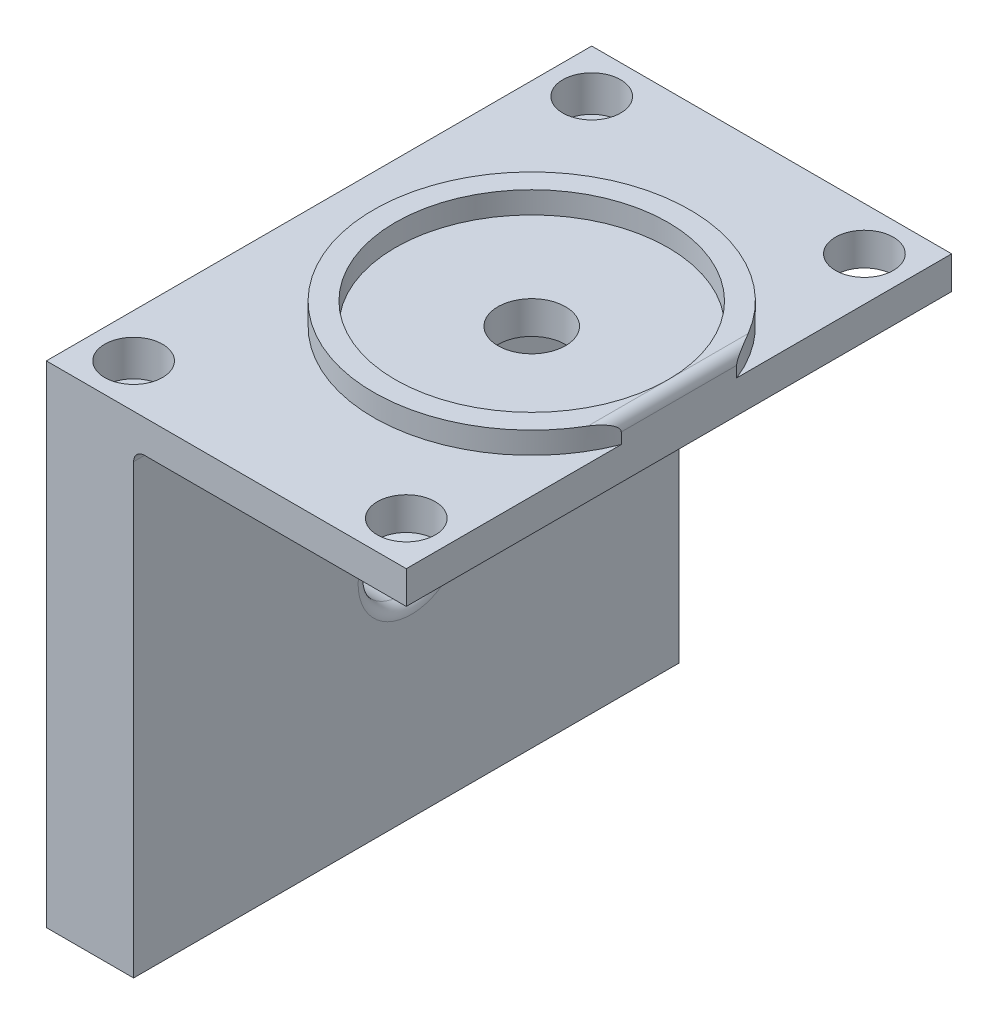
from build123d import *

# Parameters (mm, degrees)
SKETCH1_W           = 25
SKETCH1_H           = 50
SKETCH1_R           = 3.1
BOSS_EXTRUDE1_DEPTH = 3
SKETCH2_W           = 50
SKETCH2_H           = 3
BOSS_EXTRUDE2_DEPTH = 8
SKETCH3_W           = 8
SKETCH3_H           = 50
BOSS_EXTRUDE3_DEPTH = 42
SKETCH4_R           = 2.65
CUT_EXTRUDE1_DEPTH  = 3.3
SKETCH5_R           = 3.868246804
CUT_EXTRUDE2_DEPTH  = 9
FILLET2_R           = 1
SKETCH6_R           = 12.5
BOSS_EXTRUDE4_DEPTH = 2
FILLET3_R           = 1
FILLET4_R           = 1


with BuildPart() as part:
    # Sketch1 → Boss-Extrude1 (new body)
    with BuildSketch(Plane(origin=(0, 0, 0), x_dir=(1, 0, 0), z_dir=(0, 1, 0))):
        with Locations((2.276951673, 11.384758364)):
            Rectangle(SKETCH1_W, SKETCH1_H)
        with Locations(Location((1.276951673, 11.384758364, 0), (0, 0, 270))):
            Circle(SKETCH1_R, mode=Mode.SUBTRACT)
    extrude(amount=BOSS_EXTRUDE1_DEPTH)

    # Sketch2 → Boss-Extrude2 (add)
    with BuildSketch(Plane.ZY.offset(10.223048327)):
        with Locations((-11.384758364, 1.5)):
            Rectangle(SKETCH2_W, SKETCH2_H)
    extrude(amount=BOSS_EXTRUDE2_DEPTH)

    # Sketch3 → Boss-Extrude3 (add)
    with BuildSketch(Plane.XZ):
        with Locations((-14.223048327, -11.384758364)):
            Rectangle(SKETCH3_W, SKETCH3_H)
    extrude(amount=BOSS_EXTRUDE3_DEPTH)

    # Sketch4 → Cut-Extrude1 (cut)
    with BuildSketch(Plane(origin=(0, 3, 0), x_dir=(1, 0, 0), z_dir=(0, 1, 0))):
        with Locations(Location((-14.223048327, 32.384758364, 0), (0, 0, 270))):
            Circle(SKETCH4_R)
        with Locations(Location((-14.223048327, -9.615241636, 0), (0, 0, 270))):
            Circle(SKETCH4_R)
    cut_extrude1 = extrude(amount=-CUT_EXTRUDE1_DEPTH, mode=Mode.SUBTRACT)

    # Mirror1: Cut-Extrude1 across plane
    add(cut_extrude1.mirror(Plane.ZX.offset(-19.5)), mode=Mode.SUBTRACT)

    # Sketch5 → Cut-Extrude2 (cut)
    with BuildSketch(Plane.ZY.offset(18.223048327)):
        with Locations((-11.836279124, -21)):
            Circle(SKETCH5_R)
    extrude(amount=-CUT_EXTRUDE2_DEPTH, mode=Mode.SUBTRACT)

    # Fillet2
    fillet2_edges = [part.edges().sort_by_distance(p)[0] for p in [
        (-10.223048327, -21, -15.704525928),
    ]]
    fillet(fillet2_edges, radius=FILLET2_R)

    # Mirror2: Cut-Extrude1 across plane
    add(cut_extrude1.mirror(Plane.ZY.offset(1.723048327)), mode=Mode.SUBTRACT)

    # Sketch6 → Boss-Extrude4 (add)
    with BuildSketch(Plane(origin=(0, 3, 0), x_dir=(1, 0, 0), z_dir=(0, 1, 0))):
        with BuildLine():
            Line((14.776951673, 6.093255742), (14.776951673, 16.676260986))
            ThreePointArc((14.776951673, 16.676260986), (-13.223048327, 11.384758364), (14.776951673, 6.093255742))
        make_face()
        with Locations(Location((1.276951673, 11.384758364, 0), (0, 0, 270))):
            Circle(SKETCH6_R, mode=Mode.SUBTRACT)
    extrude(amount=BOSS_EXTRUDE4_DEPTH)

    # Fillet3
    fillet3_edges = [part.edges().sort_by_distance(p)[0] for p in [
        (-10.223048327, 0, -11.384758364),
    ]]
    fillet(fillet3_edges, radius=FILLET3_R)

    # Fillet4
    fillet4_edges = [part.edges().sort_by_distance(p)[0] for p in [
        (14.776951673, 5, -11.384758364),
    ]]
    fillet(fillet4_edges, radius=FILLET4_R - 0.0001)  # a hair under: the kernel refuses the full size


solid = part.part
